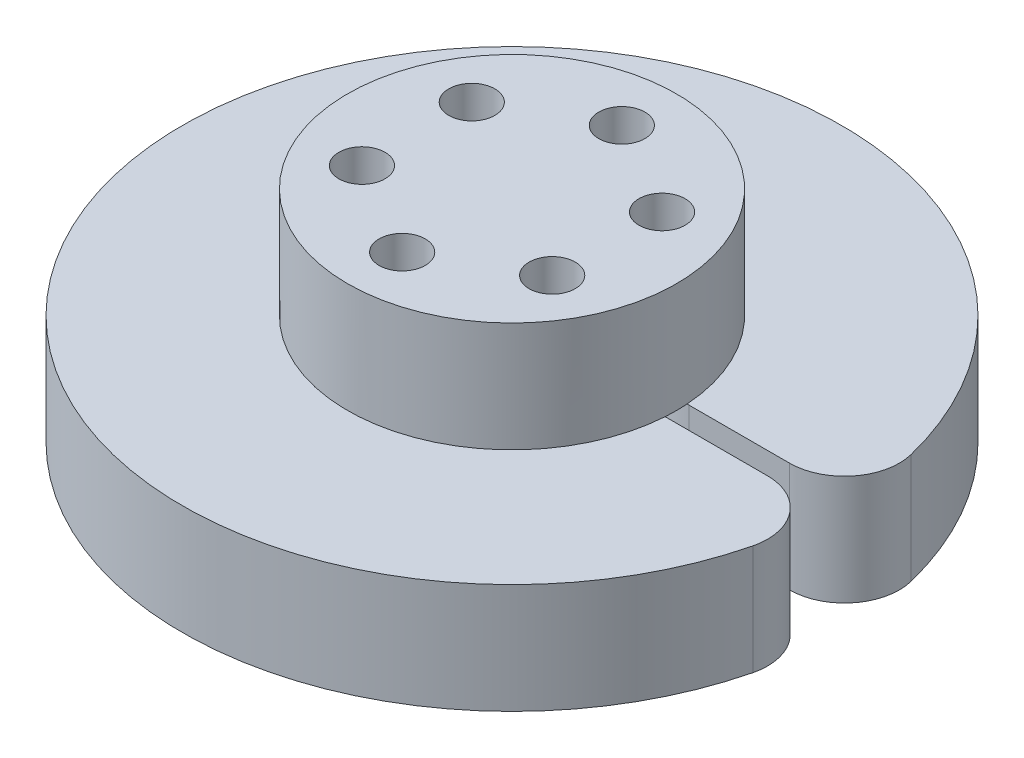
from build123d import *

# Parameters (mm, degrees)
SKETCH_1_R          = 30
EXTRUDE_1_DEPTH     = 10
SKETCH_2_R          = 14.975
EXTRUDE_2_DEPTH     = 10
EXTRUDE_START       = 6
SKETCH_3_R          = 14.975
EXTRUDE_3_DEPTH     = 6
SKETCH_4_R          = 2.1
CUT_EXTRUDE_1_DEPTH = 16
CUT_EXTRUDE_3_DEPTH = 46.343136195
FILLET_1_R          = 10
FILLET_2_R          = 5
FILLET_3_R          = 0.2
SKETCH_7_R          = 1.25
CUT_EXTRUDE_4_DEPTH = 8
SKETCH_8_R          = 2.1
CUT_EXTRUDE_5_DEPTH = 5


with BuildPart() as part:
    # 草图1 → 凸台-拉伸1 (new body)
    with BuildSketch(Plane(origin=(0, 0, 0), x_dir=(1, 0, 0), z_dir=(0, 1, 0))):
        with Locations(Location((0, 0, 0), (0, 0, 270))):
            Circle(SKETCH_1_R)
    extrude(amount=EXTRUDE_1_DEPTH)

    # 草图2 → 凸台-拉伸2 (add)
    with BuildSketch(Plane(origin=(0, 10, 0), x_dir=(1, 0, 0), z_dir=(0, 1, 0))):
        with Locations(Location((0, 0, 0), (0, 0, 270))):
            Circle(SKETCH_2_R)
    extrude(amount=EXTRUDE_2_DEPTH)

    # 草图3 → 凸台-拉伸3 (add)
    with BuildSketch(Plane.XZ.offset(EXTRUDE_START)):
        with Locations(Location((0, 0, 0), (0, 0, 90))):
            Circle(SKETCH_3_R)
    extrude(amount=-EXTRUDE_3_DEPTH)

    # 草图4 → 切除-拉伸1 (cut)
    with BuildSketch(Plane.XZ.offset(6)):
        with Locations(Location((-10, 0, 0), (0, 0, 270))):
            Circle(SKETCH_4_R)
        with Locations(Location((-5, 8.660254038, 0), (0, 0, 270))):
            Circle(SKETCH_4_R)
        with Locations(Location((5, 8.660254038, 0), (0, 0, 270))):
            Circle(SKETCH_4_R)
        with Locations(Location((5, -8.660254038, 0), (0, 0, 270))):
            Circle(SKETCH_4_R)
        with Locations(Location((-5, -8.660254038, 0), (0, 0, 270))):
            Circle(SKETCH_4_R)
    extrude(amount=-CUT_EXTRUDE_1_DEPTH, mode=Mode.SUBTRACT)

    # 草图6 → 切除-拉伸3 (cut, through all)
    with BuildSketch(Plane(origin=(0, 10, 0), x_dir=(1, 0, 0), z_dir=(0, 1, 0))):
        with BuildLine():
            Line((10.93428015, 1), (30.93428015, 1))
            Line((30.93428015, 1), (30.93428015, -1))
            Line((30.93428015, -1), (10.93428015, -1))
            ThreePointArc((10.93428015, -1), (4.9, 0), (10.93428015, 1))
        make_face()
    extrude(amount=-CUT_EXTRUDE_3_DEPTH, mode=Mode.SUBTRACT)

    # 圆角1
    # the kernel refuses this fillet: 10 mm, written as the material it takes off along each edge
    with BuildSketch(Plane(origin=(10.93428015, 10, -1), x_dir=(1, 0, 0), z_dir=(0, -1, 0))) as fillet_1_piece_1:
        with BuildLine():
            CenterArc((4.179790415, -10), FILLET_1_R, 90, 32.892109865)
            ThreePointArc((-1.250797803, -1.603053435), (-0.490230703, -0.906992999), (0, 0))
            Line((0, 0), (4.179790415, 0))
        make_face()
    extrude(amount=26.449476036, mode=Mode.SUBTRACT)
    with BuildSketch(Plane(origin=(10.93428015, 10, 1), x_dir=(1, 0, 0), z_dir=(0, -1, 0))) as fillet_1_piece_2:
        with BuildLine():
            CenterArc((4.179790415, 10), FILLET_1_R, 237.107890135, 32.892109865)
            ThreePointArc((-1.250797803, 1.603053435), (-0.490230703, 0.906992999), (0, 0))
            Line((0, 0), (4.179790415, 0))
        make_face()
    extrude(amount=26.449476036, mode=Mode.SUBTRACT)

    # 圆角2
    fillet_2_edges = [part.edges().sort_by_distance(p)[0] for p in [
        (29.983328701, 5, -1),
        (29.983328701, 5, 1),
    ]]
    fillet(fillet_2_edges, radius=FILLET_2_R)

    # 圆角3
    fillet_3_edges = [part.edges().sort_by_distance(p)[0] for p in [
        (14.941473943, -3, 1.001489591),
        (14.941473943, -3, -1.001489591),
    ]]
    fillet(fillet_3_edges, radius=FILLET_3_R)

    # 草图7 → 切除-拉伸4 (cut)
    with BuildSketch(Plane.XZ.offset(-10)):
        with Locations(Location((8, 0, 0), (0, 0, 270))):
            Circle(SKETCH_7_R)
    extrude(amount=-CUT_EXTRUDE_4_DEPTH, mode=Mode.SUBTRACT)

    # 草图8 → 切除-拉伸5 (cut)
    with BuildSketch(Plane(origin=(0, 20, 0), x_dir=(1, 0, 0), z_dir=(0, 1, 0))):
        with Locations(Location((-8.660254038, 5, 0), (0, 0, 270))):
            Circle(SKETCH_8_R)
        with Locations(Location((0, 10, 0), (0, 0, 270))):
            Circle(SKETCH_8_R)
        with Locations(Location((8.660254038, 5, 0), (0, 0, 270))):
            Circle(SKETCH_8_R)
        with Locations(Location((8.660254038, -5, 0), (0, 0, 270))):
            Circle(SKETCH_8_R)
        with Locations(Location((0, -10, 0), (0, 0, 270))):
            Circle(SKETCH_8_R)
        with Locations(Location((-8.660254038, -5, 0), (0, 0, 270))):
            Circle(SKETCH_8_R)
    extrude(amount=-CUT_EXTRUDE_5_DEPTH, mode=Mode.SUBTRACT)


solid = part.part
